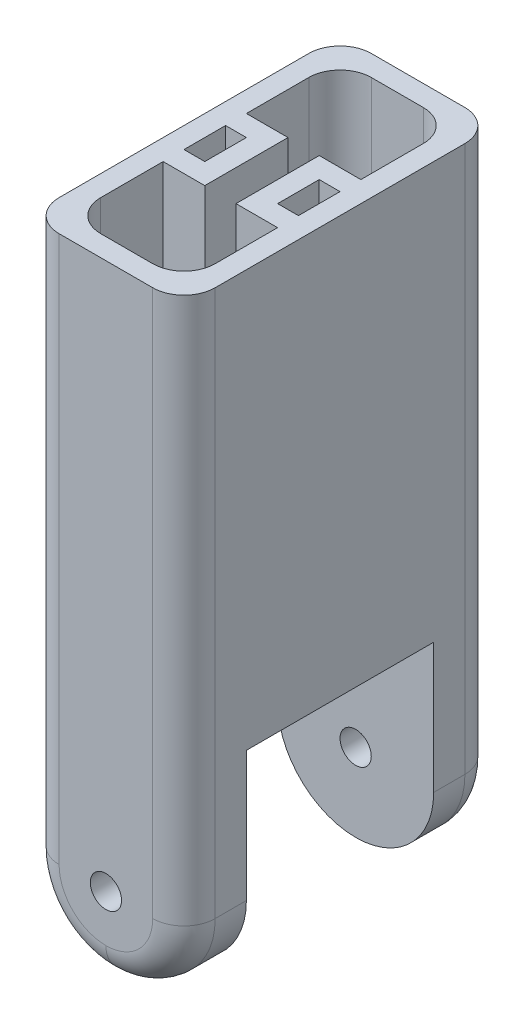
from build123d import *

# Parameters (mm, degrees)
SKETCH1_W           = 15
SKETCH1_H           = 30
SKETCH1_W_2         = 2
SKETCH1_H_2         = 4
BOSS_EXTRUDE1_DEPTH = 40
SKETCH2_W           = 15
SKETCH2_H           = 6
BOSS_EXTRUDE2_DEPTH = 20
FILLET1_R           = 7.5
SKETCH3_R           = 1.5
CUT_EXTRUDE1_DEPTH  = 51.55937104
FILLET2_R           = 3


with BuildPart() as part:
    # Sketch1 → Boss-Extrude1 (new body)
    with BuildSketch(Plane(origin=(0, 0, 0), x_dir=(1, 0, 0), z_dir=(0, 1, 0))):
        Rectangle(SKETCH1_W, SKETCH1_H)
        Polygon((-5.5, -13), (5.5, -13), (5.5, -4), (1.5, -4), (1.5, 4), (5.5, 4), (5.5, 13), (-5.5, 13), (-5.5, 4), (-1.5, 4), (-1.5, -4), (-5.5, -4), align=None, mode=Mode.SUBTRACT)
        with Locations((-4.5, 0)):
            Rectangle(SKETCH1_W_2, SKETCH1_H_2, mode=Mode.SUBTRACT)
        with Locations((4.5, 0)):
            Rectangle(SKETCH1_W_2, SKETCH1_H_2, mode=Mode.SUBTRACT)
    extrude(amount=BOSS_EXTRUDE1_DEPTH)

    # Sketch2 → Boss-Extrude2 (add)
    with BuildSketch(Plane.XZ):
        with Locations((0, 12)):
            Rectangle(SKETCH2_W, SKETCH2_H)
        with Locations((0, -12)):
            Rectangle(SKETCH2_W, SKETCH2_H)
    extrude(amount=BOSS_EXTRUDE2_DEPTH)

    # Fillet1
    fillet1_edges = [part.edges().sort_by_distance(p)[0] for p in [
        (-7.5, -20, 12),
        (-7.5, -20, -12),
        (7.5, -20, -12),
        (7.5, -20, 12),
    ]]
    fillet(fillet1_edges, radius=FILLET1_R - 0.0001)  # a hair under: the kernel refuses the full size

    # Sketch3 → Cut-Extrude1 (cut, through all)
    with BuildSketch(Plane.XY.offset(15)):
        with Locations((0, -12.5)):
            Circle(SKETCH3_R)
    extrude(amount=-CUT_EXTRUDE1_DEPTH, mode=Mode.SUBTRACT)

    # Fillet2
    fillet2_edges = [part.edges().sort_by_distance(p)[0] for p in [
        (5.303330148, -17.803330148, 15),
        (-5.303330148, -17.803330148, 15),
        (5.303330148, -17.803330148, -15),
        (-5.303330148, -17.803330148, -15),
        (5.5, 20, -13),
        (-5.5, 20, -13),
        (-5.5, 20, 13),
        (5.5, 20, 13),
        (7.5, 13.74995, 15),
        (-7.5, 13.74995, 15),
        (-7.5, 13.74995, -15),
        (7.5, 13.74995, -15),
    ]]
    fillet(fillet2_edges, radius=FILLET2_R)


solid = part.part
